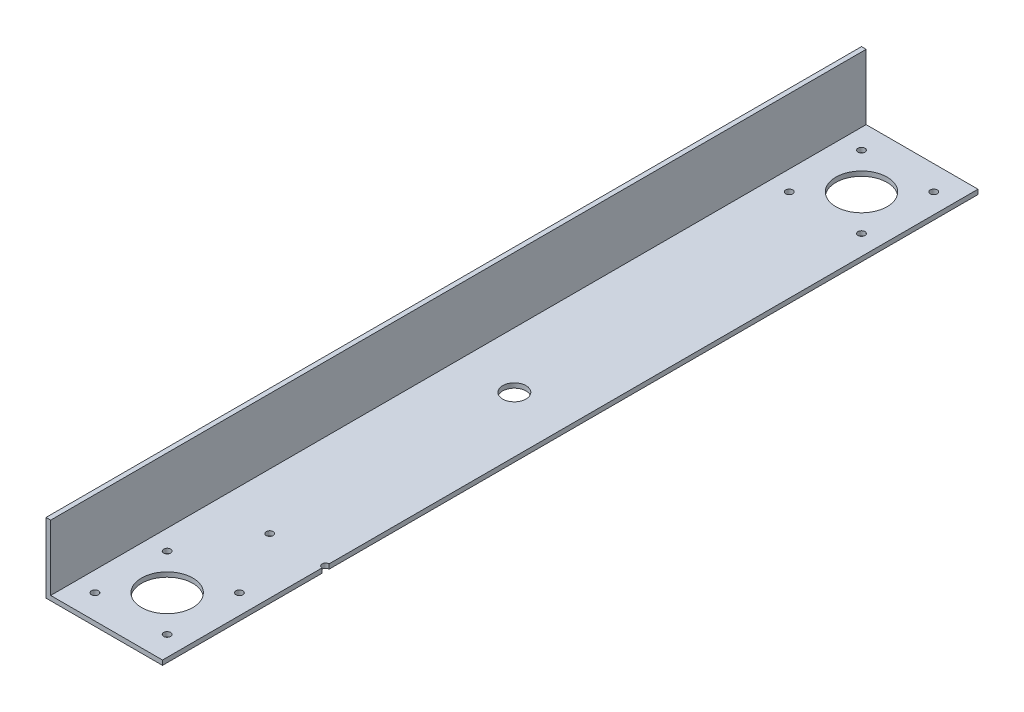
from build123d import *

# Parameters (mm, degrees)
BOSS_EXTRUDE1_DEPTH      = 350
SKETCH6_R                = 1.5
CUT_EXTRUDE3_DEPTH       = 355.660400947
SKETCH7_R                = 11
CUT_EXTRUDE4_DEPTH       = 355.660400947
SKETCH8_R                = 11
CUT_EXTRUDE5_DEPTH       = 355.823899984
SKETCH9_R                = 1.5
CUT_EXTRUDE6_DEPTH       = 355.823899984
SKETCH10_R               = 5
CUT_EXTRUDE7_DEPTH       = 355.823899984
F_3_0_3_DIAMETER_HOLE1_D = 3


with BuildPart() as part:
    # Sketch1 → Boss-Extrude1 (new body)
    with BuildSketch(Plane.XY):
        Polygon((0, 0), (0, 30), (2, 30), (2, 2), (50, 2), (50, 0), align=None)
    extrude(amount=BOSS_EXTRUDE1_DEPTH)

    # Sketch6 → Cut-Extrude3 (cut, through all)
    with BuildSketch(Plane(origin=(0, 2, 0), x_dir=(1, 0, 0), z_dir=(0, 1, 0))):
        with Locations((41.5, -339.5)):
            Circle(SKETCH6_R)
        with Locations((10.5, -308.5)):
            Circle(SKETCH6_R)
        with Locations((10.5, -339.5)):
            Circle(SKETCH6_R)
        with Locations((41.5, -308.5)):
            Circle(SKETCH6_R)
    extrude(amount=-CUT_EXTRUDE3_DEPTH, mode=Mode.SUBTRACT)

    # Sketch7 → Cut-Extrude4 (cut, through all)
    with BuildSketch(Plane(origin=(0, 2, 0), x_dir=(1, 0, 0), z_dir=(0, 1, 0))):
        with Locations((26, -324)):
            Circle(SKETCH7_R)
    extrude(amount=-CUT_EXTRUDE4_DEPTH, mode=Mode.SUBTRACT)

    # Sketch8 → Cut-Extrude5 (cut, through all)
    with BuildSketch(Plane(origin=(0, 0, 0), x_dir=(-1, 0, 0), z_dir=(0, -1, 0))):
        with Locations((-26, -26)):
            Circle(SKETCH8_R)
    extrude(amount=-CUT_EXTRUDE5_DEPTH, mode=Mode.SUBTRACT)

    # Sketch9 → Cut-Extrude6 (cut, through all)
    with BuildSketch(Plane.XZ):
        with Locations((41.5, 41.5)):
            Circle(SKETCH9_R)
        with Locations((10.5, 41.5)):
            Circle(SKETCH9_R)
        with Locations((10.5, 10.5)):
            Circle(SKETCH9_R)
        with Locations((41.5, 10.5)):
            Circle(SKETCH9_R)
    extrude(amount=-CUT_EXTRUDE6_DEPTH, mode=Mode.SUBTRACT)

    # Sketch10 → Cut-Extrude7 (cut, through all)
    with BuildSketch(Plane.XZ):
        with Locations((26.000000572, 175)):
            Circle(SKETCH10_R)
    extrude(amount=-CUT_EXTRUDE7_DEPTH, mode=Mode.SUBTRACT)

    # Ø3.0 (3) Diameter Hole1 (through all)
    with Locations(Plane(origin=(-11.407632793, 2, 221.138003919), x_dir=(0, 0, 1), z_dir=(0, 1, 0))):
        with Locations((58.861996081, 61.407632793), (58.861996081, 37.407632793)):
            Hole(F_3_0_3_DIAMETER_HOLE1_D / 2)


solid = part.part
